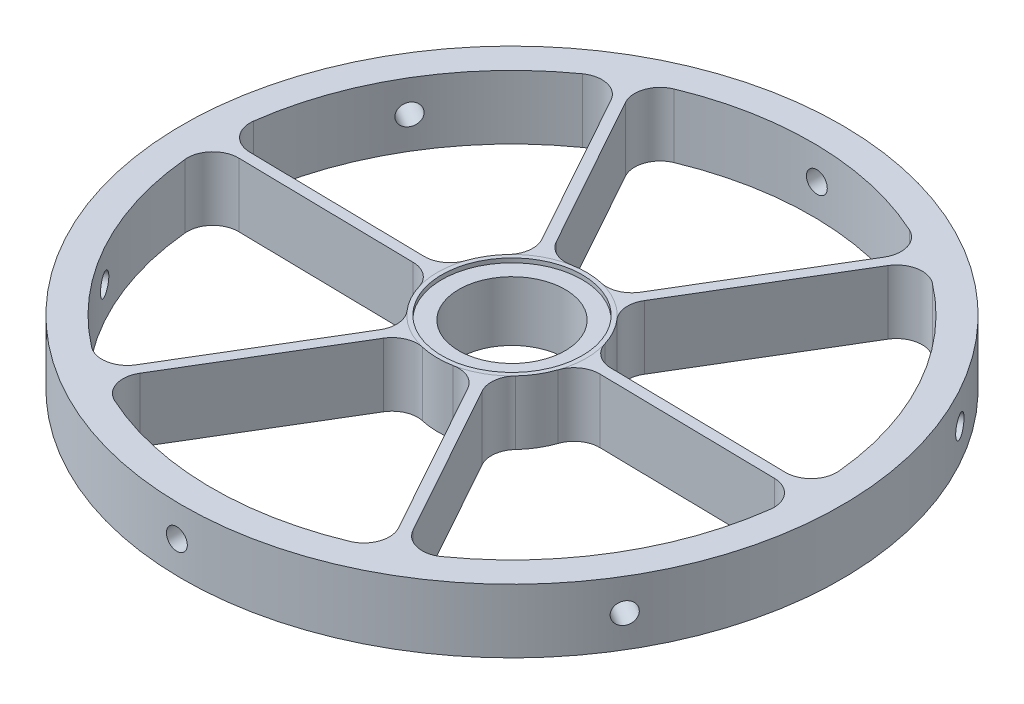
from build123d import *

# Parameters (mm, degrees)
CENTER_RING_R               = 22.225
CENTER_RING_R_2             = 15.875
CENTER_DEPTH                = 9.525
OUTER_R                     = 98.425
OUTER_R_2                   = 89.535
OUTER_RING_DEPTH            = 9.525
BEAM_REACH                  = 178.377
BEAM_END_RADIUS             = 22.225
BEEAM_W                     = 3.175
BEEAM_H                     = 19.05
BEAM_DIRECTION_2_REACH      = 178.377
BEAM_DIRECTION_2_END_RADIUS = 89.535
CIRPATTERN1_COUNT           = 6
FILLET1_R                   = 7.62
SKETCH27_R                  = 20.955
CUT_EXTRUDE3_DEPTH          = 1.27
CUT_EXTRUDE5_REACH          = 237.839
SKETCH31_R                  = 3.175
CIRPATTERN5_COUNT           = 6
BODY_MOVE_COPY7_ANGLE       = 31


with BuildPart() as part:
    # Center Ring → Center (new, symmetric)
    with BuildSketch(Plane(origin=(0, 0, 0), x_dir=(1, 0, 0), z_dir=(0, 1, 0))):
        Circle(CENTER_RING_R)
        Circle(CENTER_RING_R_2, mode=Mode.SUBTRACT)
    extrude(amount=CENTER_DEPTH, both=True)



with BuildPart() as body_2:
    # Outer → Outer Ring (new, symmetric)
    with BuildSketch(Plane(origin=(0, 0, 0), x_dir=(1, 0, 0), z_dir=(0, 1, 0))):
        Circle(OUTER_R)
        Circle(OUTER_R_2, mode=Mode.SUBTRACT)
    extrude(amount=OUTER_RING_DEPTH, both=True)


with BuildPart() as part_1:
    add(part.part)

    add(body_2.part)  # Beam merges body 2
    # Beam: up to this cylinder (the profile starts outside it)
    beam_end = Plane(origin=(0, 0, 0), z_dir=(0, -1, 0)) * Cylinder(BEAM_END_RADIUS, 402.204, mode=Mode.PRIVATE)
    # beeam → Beam (add, up to the surface)
    with BuildSketch(Plane.XY.offset(47.625), mode=Mode.PRIVATE) as beam_sk1:
        Rectangle(BEEAM_W, BEEAM_H)
    beam_tool1 = extrude(beam_sk1.sketch, amount=-BEAM_REACH, mode=Mode.PRIVATE) - beam_end
    beam = beam_tool1.solids().sort_by_distance((0, 0, 47.625))[0]
    add(beam)

    # Beam direction 2: up to this cylinder (the profile starts inside it)
    beam_direction_2_end = Plane(origin=(0, 0, 0), z_dir=(0, -1, 0)) * Cylinder(BEAM_DIRECTION_2_END_RADIUS, 536.824, mode=Mode.PRIVATE)
    # beeam → Beam direction 2 (add, up to the surface)
    with BuildSketch(Plane.XY.offset(47.625), mode=Mode.PRIVATE) as beam_direction_2_sk1:
        Rectangle(BEEAM_W, BEEAM_H)
    beam_direction_2_tool1 = extrude(beam_direction_2_sk1.sketch, amount=BEAM_DIRECTION_2_REACH, mode=Mode.PRIVATE) & beam_direction_2_end
    beam_direction_2 = beam_direction_2_tool1.solids().sort_by_distance((0, 0, 47.625))[0]
    add(beam_direction_2)
    beam = beam + beam_direction_2  # both directions under the feature's name, for the pattern or mirror that repeats it

    # CirPattern1: Beam ×6 about axis
    cirpattern1_axis = Axis((0, 9.525, 0), (0, -1, 0))
    for i in range(1, CIRPATTERN1_COUNT):
        add(beam.rotate(cirpattern1_axis, i * 360 / CIRPATTERN1_COUNT))

    # Fillet1
    fillet1_edges = [part_1.edges().sort_by_distance(p)[0] for p in [
        (78.321145491, 0, 43.385647328),
        (76.733645491, 0, 46.135277985),
        (-18.404501263, 0, -12.458930863),
        (-1.5875, 0, -22.168231069),
        (1.5875, 0, -22.168231069),
        (18.404501263, 0, -12.458930863),
        (19.992001263, 0, -9.709300206),
        (19.992001263, 0, 9.709300206),
        (18.404501263, 0, 12.458930863),
        (1.5875, 0, 22.168231069),
        (-18.404501263, 0, 12.458930863),
        (-1.5875, 0, 22.168231069),
        (-19.992001263, 0, 9.709300206),
        (-19.992001263, 0, -9.709300206),
        (1.5875, 0, 89.520925312),
        (-1.5875, 0, 89.520925312),
        (-76.733645491, 0, 46.135277985),
        (-78.321145491, 0, 43.385647328),
        (78.321145491, 0, -43.385647328),
        (76.733645491, 0, -46.135277985),
        (1.5875, 0, -89.520925312),
        (-1.5875, 0, -89.520925312),
        (-76.733645491, 0, -46.135277985),
        (-78.321145491, 0, -43.385647328),
    ]]
    fillet(fillet1_edges, radius=FILLET1_R)

    # Sketch27 → Cut-Extrude3 (cut)
    with BuildSketch(Plane(origin=(0, 9.525, 0), x_dir=(1, 0, 0), z_dir=(0, 1, 0))):
        Circle(SKETCH27_R)
    extrude(amount=-CUT_EXTRUDE3_DEPTH, mode=Mode.SUBTRACT)

    # Sketch31 → Cut-Extrude5 (cut, up to next)
    with BuildSketch(Plane(origin=(49.2125, 0, 85.238550367), x_dir=(0, -1, 0), z_dir=(0.49999999999999495, 0, 0.8660254037844416)), mode=Mode.PRIVATE) as cut_extrude5_sk1:
        Circle(SKETCH31_R)
    cut_extrude5_tool1 = extrude(cut_extrude5_sk1.sketch, amount=-CUT_EXTRUDE5_REACH, mode=Mode.PRIVATE) & part_1.part
    cut_extrude5 = cut_extrude5_tool1.solids().sort_by_distance((49.2125, 0, 85.23855))[0]
    add(cut_extrude5, mode=Mode.SUBTRACT)

    # CirPattern5: Cut-Extrude5 ×6 about axis
    cirpattern5_axis = Axis((0, 9.525, 0), (0, -1, 0))
    for i in range(1, CIRPATTERN5_COUNT):
        add(cut_extrude5.rotate(cirpattern5_axis, i * 360 / CIRPATTERN5_COUNT), mode=Mode.SUBTRACT)


with BuildPart() as part_2:
    # Body-Move/Copy7: moved
    add(part_1.part.rotate(Axis((0, 0, 0), (0, -1, 0)), BODY_MOVE_COPY7_ANGLE))


solid = part_2.part
